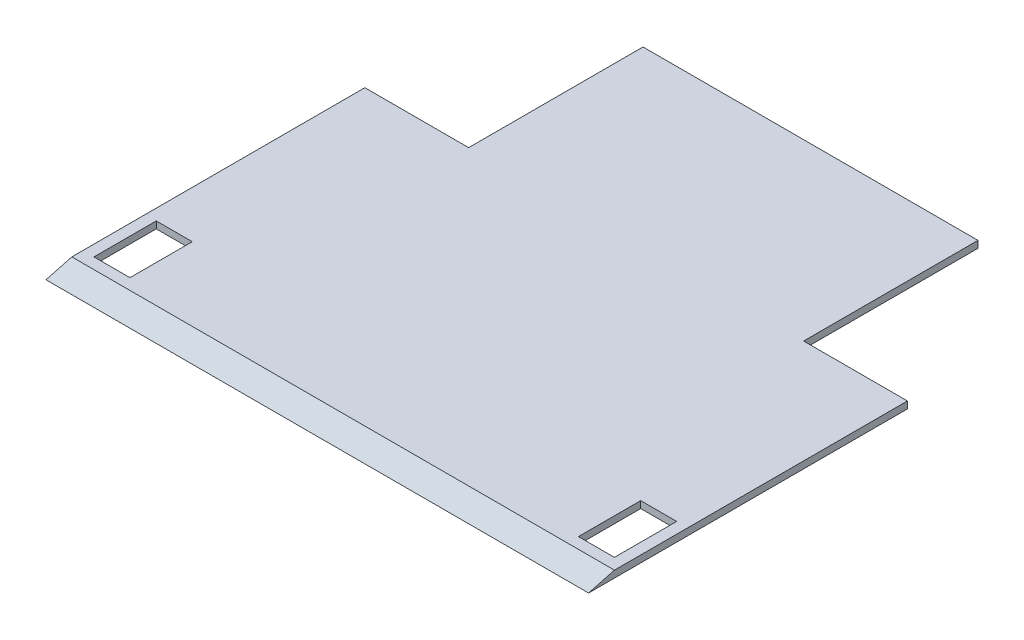
from build123d import *

# Parameters (mm, degrees)
SALIENTE_EXTRUIR1_DEPTH = 196
CORTAR_EXTRUIR1_REACH   = 266.89
CROQUIS2_W              = 37.5
CROQUIS2_H              = 62.989872981
CORTAR_EXTRUIR2_REACH   = 266.89
CROQUIS4_W              = 13
CROQUIS4_H              = 22.5


with BuildPart() as part:
    # Croquis1 → Saliente-Extruir1 (new body)
    with BuildSketch(Plane(origin=(0, 0, 0), x_dir=(0, 0, -1), z_dir=(1, 0, 0))):
        Polygon((0, 0), (178.17, 0), (178.17, 2.5), (9.330127019, 2.5), align=None)
    extrude(amount=SALIENTE_EXTRUIR1_DEPTH)

    # Croquis2 → Cortar-Extruir1 (cut, up to next)
    with BuildSketch(Plane(origin=(0, 0, 0), x_dir=(-1, 0, 0), z_dir=(0, -1, 0)), mode=Mode.PRIVATE) as cortar_extruir1_sk1:
        with Locations((-18.75, 146.67506351)):
            Rectangle(CROQUIS2_W, CROQUIS2_H)
    cortar_extruir1_tool1 = extrude(cortar_extruir1_sk1.sketch, amount=-CORTAR_EXTRUIR1_REACH, mode=Mode.PRIVATE) & part.part
    # Croquis2 → Cortar-Extruir1 (cut, up to next)
    with BuildSketch(Plane(origin=(0, 0, 0), x_dir=(-1, 0, 0), z_dir=(0, -1, 0)), mode=Mode.PRIVATE) as cortar_extruir1_sk2:
        with Locations((-177.25, 146.67506351)):
            Rectangle(CROQUIS2_W, CROQUIS2_H)
    cortar_extruir1_tool2 = extrude(cortar_extruir1_sk2.sketch, amount=-CORTAR_EXTRUIR1_REACH, mode=Mode.PRIVATE) & part.part
    add(cortar_extruir1_tool1.solids().sort_by_distance((18.75, 0, -146.675064))[0], mode=Mode.SUBTRACT)
    add(cortar_extruir1_tool2.solids().sort_by_distance((177.25, 0, -146.675064))[0], mode=Mode.SUBTRACT)

    # Croquis4 → Cortar-Extruir2 (cut, up to next)
    with BuildSketch(Plane(origin=(0, 2.5, 0), x_dir=(1, 0, 0), z_dir=(0, 1, 0)), mode=Mode.PRIVATE) as cortar_extruir2_sk1:
        with Locations((10.5, 24.580127019)):
            Rectangle(CROQUIS4_W, CROQUIS4_H)
    cortar_extruir2_tool1 = extrude(cortar_extruir2_sk1.sketch, amount=-CORTAR_EXTRUIR2_REACH, mode=Mode.PRIVATE) & part.part
    cortar_extruir2 = cortar_extruir2_tool1.solids().sort_by_distance((10.5, 2.5, -24.580127))[0]
    add(cortar_extruir2, mode=Mode.SUBTRACT)

    # Simetría1: Cortar-Extruir2 across plane
    add(cortar_extruir2.mirror(Plane(origin=(98, 0, 0), x_dir=(0, 0, 1), z_dir=(1, 0, 0))), mode=Mode.SUBTRACT)


solid = part.part
